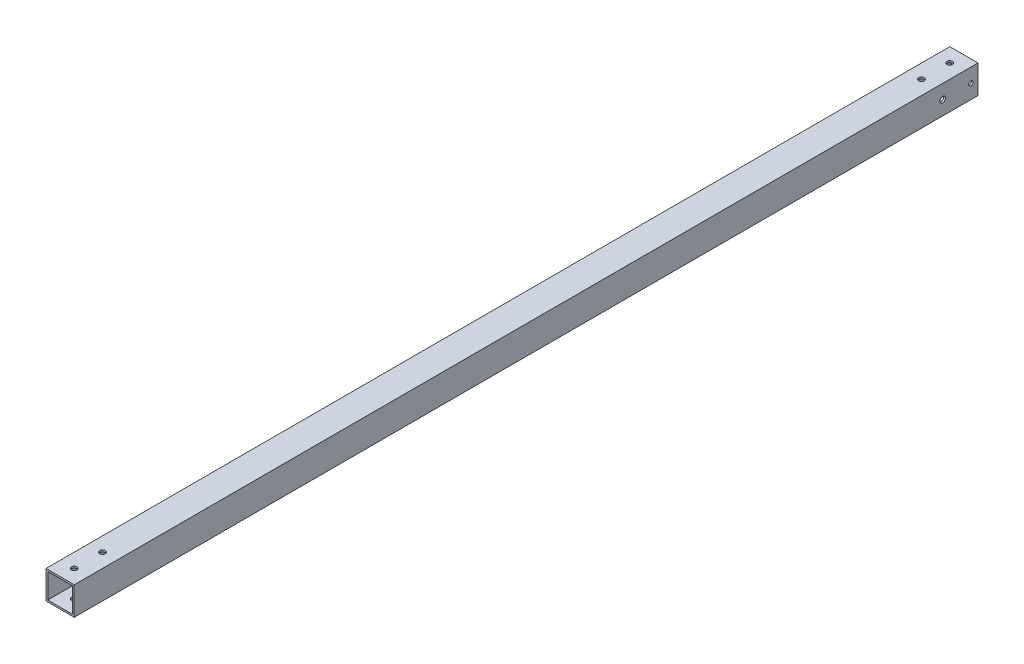
from build123d import *

# Parameters (mm, degrees)
SKETCH1_W           = 25.4
SKETCH1_H           = 25.4
SKETCH1_W_2         = 22.225
SKETCH1_H_2         = 22.225
BOSS_EXTRUDE1_DEPTH = 812.8
SKETCH3_R           = 2.54
CUT_EXTRUDE2_DEPTH  = 814.593362805
CUT_EXTRUDE3_REACH  = 815.593
SKETCH4_R           = 2.003399785
SKETCH4_R_2         = 2.54
CUT_EXTRUDE4_REACH  = 815.593
SKETCH5_R           = 2.54


with BuildPart() as part:
    # Sketch1 → Boss-Extrude1 (new body)
    with BuildSketch(Plane.XY):
        with Locations((12.7, 12.7)):
            Rectangle(SKETCH1_W, SKETCH1_H)
        with Locations((12.7, 12.7)):
            Rectangle(SKETCH1_W_2, SKETCH1_H_2, mode=Mode.SUBTRACT)
    extrude(amount=BOSS_EXTRUDE1_DEPTH)

    # Sketch3 → Cut-Extrude2 (cut, through all)
    with BuildSketch(Plane(origin=(0, 25.4, 0), x_dir=(1, 0, 0), z_dir=(0, 1, 0))):
        with Locations((12.7, -12.7)):
            Circle(SKETCH3_R)
        with Locations((12.7, -38.1)):
            Circle(SKETCH3_R)
        with Locations((12.7, -774.7)):
            Circle(SKETCH3_R)
        with Locations((12.7, -800.1)):
            Circle(SKETCH3_R)
    extrude(amount=-CUT_EXTRUDE2_DEPTH, mode=Mode.SUBTRACT)

    # Sketch4 → Cut-Extrude3 (cut, up to next)
    with BuildSketch(Plane(origin=(25.4, 0, 0), x_dir=(0, 0, -1), z_dir=(1, 0, 0)), mode=Mode.PRIVATE) as cut_extrude3_sk1:
        with Locations((-6.35, 12.7)):
            Circle(SKETCH4_R)
    cut_extrude3_tool1 = extrude(cut_extrude3_sk1.sketch, amount=-CUT_EXTRUDE3_REACH, mode=Mode.PRIVATE) & part.part
    # Sketch4 → Cut-Extrude3 (cut, up to next)
    with BuildSketch(Plane(origin=(25.4, 0, 0), x_dir=(0, 0, -1), z_dir=(1, 0, 0)), mode=Mode.PRIVATE) as cut_extrude3_sk2:
        with Locations((-31.75, 12.7)):
            Circle(SKETCH4_R_2)
    cut_extrude3_tool2 = extrude(cut_extrude3_sk2.sketch, amount=-CUT_EXTRUDE3_REACH, mode=Mode.PRIVATE) & part.part
    add(cut_extrude3_tool1.solids().sort_by_distance((25.4, 12.7, 6.35))[0], mode=Mode.SUBTRACT)
    add(cut_extrude3_tool2.solids().sort_by_distance((25.4, 12.7, 31.75))[0], mode=Mode.SUBTRACT)

    # Sketch5 → Cut-Extrude4 (cut, up to next)
    with BuildSketch(Plane.ZY, mode=Mode.PRIVATE) as cut_extrude4_sk1:
        with Locations((39.6875, 12.7)):
            Circle(SKETCH5_R)
    cut_extrude4_tool1 = extrude(cut_extrude4_sk1.sketch, amount=-CUT_EXTRUDE4_REACH, mode=Mode.PRIVATE) & part.part
    # Sketch5 → Cut-Extrude4 (cut, up to next)
    with BuildSketch(Plane.ZY, mode=Mode.PRIVATE) as cut_extrude4_sk2:
        with Locations((730.25, 12.7)):
            Circle(SKETCH5_R)
    cut_extrude4_tool2 = extrude(cut_extrude4_sk2.sketch, amount=-CUT_EXTRUDE4_REACH, mode=Mode.PRIVATE) & part.part
    # Sketch5 → Cut-Extrude4 (cut, up to next)
    with BuildSketch(Plane.ZY, mode=Mode.PRIVATE) as cut_extrude4_sk3:
        with Locations((755.65, 12.7)):
            Circle(SKETCH5_R)
    cut_extrude4_tool3 = extrude(cut_extrude4_sk3.sketch, amount=-CUT_EXTRUDE4_REACH, mode=Mode.PRIVATE) & part.part
    add(cut_extrude4_tool1.solids().sort_by_distance((0, 12.7, 39.6875))[0], mode=Mode.SUBTRACT)
    add(cut_extrude4_tool2.solids().sort_by_distance((0, 12.7, 730.25))[0], mode=Mode.SUBTRACT)
    add(cut_extrude4_tool3.solids().sort_by_distance((0, 12.7, 755.65))[0], mode=Mode.SUBTRACT)


solid = part.part
